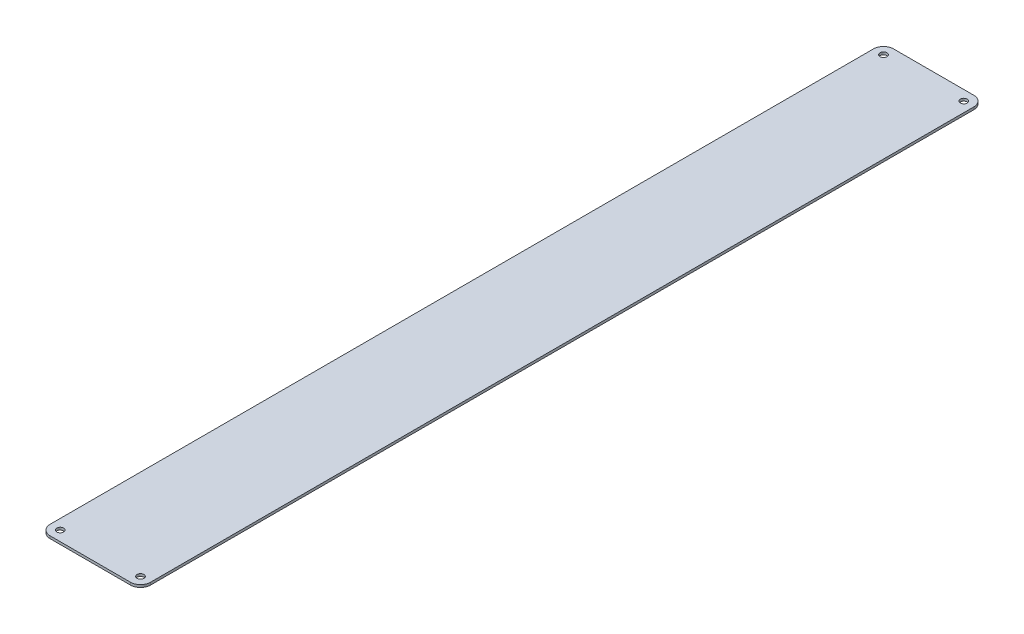
from build123d import *

# Parameters (mm, degrees)
SKETCH1_R           = 2.1828125
BOSS_EXTRUDE1_DEPTH = 0.79375


with BuildPart() as part:
    # Sketch1 → Boss-Extrude1 (new, symmetric)
    with BuildSketch(Plane(origin=(0, 0, 0), x_dir=(1, 0, 0), z_dir=(0, 1, 0))):
        with BuildLine():
            Line((6.35, 0), (57.15, 0))
            ThreePointArc((57.15, 0), (61.640128061, 1.859871939), (63.5, 6.35))
            Line((63.5, 6.35), (63.5, 527.05))
            ThreePointArc((63.5, 527.05), (61.640128061, 531.540128061), (57.15, 533.4))
            Line((57.15, 533.4), (6.35, 533.4))
            ThreePointArc((6.35, 533.4), (1.859871939, 531.540128061), (0, 527.05))
            Line((0, 527.05), (0, 6.35))
            ThreePointArc((0, 6.35), (1.859871939, 1.859871939), (6.35, 0))
        make_face()
        with Locations((57.15, 527.05)):
            Circle(SKETCH1_R, mode=Mode.SUBTRACT)
        with Locations((6.35, 527.05)):
            Circle(SKETCH1_R, mode=Mode.SUBTRACT)
        with Locations((6.35, 6.35)):
            Circle(SKETCH1_R, mode=Mode.SUBTRACT)
        with Locations((57.15, 6.35)):
            Circle(SKETCH1_R, mode=Mode.SUBTRACT)
    extrude(amount=BOSS_EXTRUDE1_DEPTH, both=True)


solid = part.part
